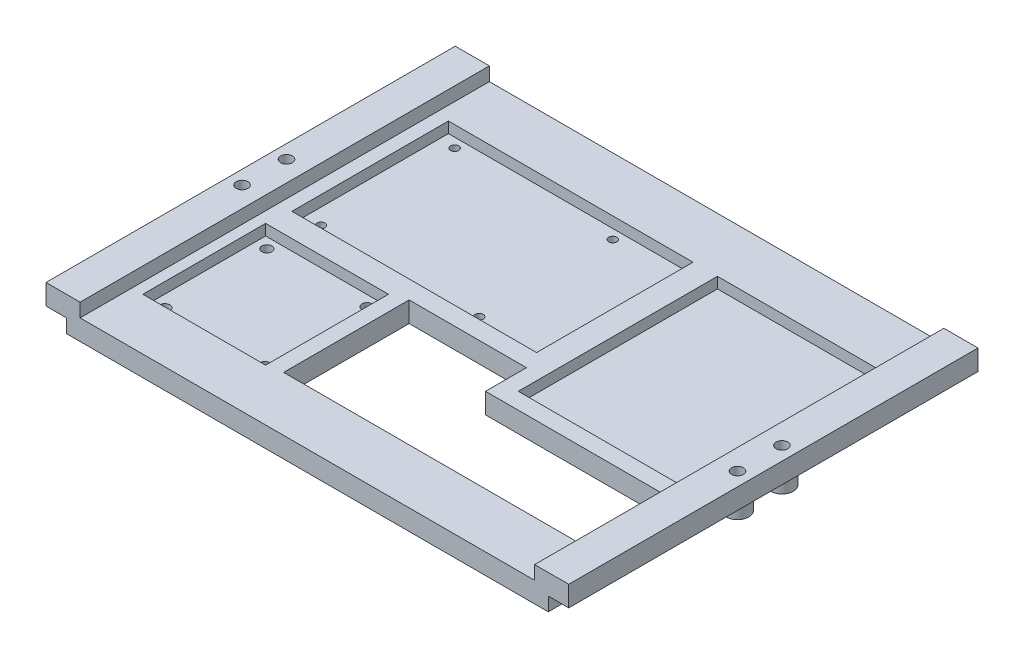
from build123d import *

# Parameters (mm, degrees)
PLATEFRAME_DEPTH          = 150
SKETCH3_R                 = 2.15
HOLESUPPORT_DEPTH         = 7.5
SKETCH4_R                 = 4.15
SKETCH4_R_2               = 2.15
CYLINDRICALSUPPORTS_DEPTH = 12.5
SKETCH5_W                 = 43
SKETCH5_H                 = 43
SKETCH5_W_2               = 89.65
SKETCH5_H_2               = 57.35
SKETCH5_W_3               = 58
SKETCH5_H_3               = 73
ITEMLAYOUT_DEPTH          = 4
HOLECUTOUT_DEPTH          = 7.5
SKETCH7_R                 = 1.5
HOLERASPBERRYPI_DEPTH     = 3.5
SKETCH8_R                 = 1.85
HOLEMOTORDRIVER_DEPTH     = 3.5
SKETCH10_W                = 45
SKETCH10_H                = 45
SKETCH10_W_2              = 43
SKETCH10_H_2              = 43
CUTMOTORDRIVER_DEPTH      = 4


with BuildPart() as part:
    # Sketch2 → PlateFrame (new body)
    with BuildSketch(Plane.XY):
        Polygon((179.1, 12.5), (191.6, 12.5), (191.6, 5), (184.1, 5), (184.1, 0), (7.5, 0), (7.5, 5), (0, 5), (0, 12.5), (12.5, 12.5), (12.5, 7.5), (179.1, 7.5), align=None)
    extrude(amount=PLATEFRAME_DEPTH)

    # Sketch3 → HoleSupport (cut)
    with BuildSketch(Plane(origin=(0, 12.5, 0), x_dir=(1, 0, 0), z_dir=(0, 1, 0))):
        with Locations((5, -66.85)):
            Circle(SKETCH3_R)
        with Locations((5, -83.15)):
            Circle(SKETCH3_R)
        with Locations((186.6, -66.85)):
            Circle(SKETCH3_R)
        with Locations((186.6, -83.15)):
            Circle(SKETCH3_R)
    extrude(amount=-HOLESUPPORT_DEPTH, mode=Mode.SUBTRACT)

    # Sketch4 → CylindricalSupports (add)
    # profile 1 of 4: a face of its own
    with BuildSketch(Plane(origin=(0, 12.5, 0), x_dir=(1, 0, 0), z_dir=(0, 1, 0))):
        with Locations((186.6, -66.85)):
            Circle(SKETCH4_R)
        with Locations((186.6, -66.85)):
            Circle(SKETCH4_R_2, mode=Mode.SUBTRACT)
    # profile 2 of 4: a face of its own
    with BuildSketch(Plane(origin=(0, 12.5, 0), x_dir=(1, 0, 0), z_dir=(0, 1, 0))):
        with Locations((186.6, -83.15)):
            Circle(SKETCH4_R)
        with Locations((186.6, -83.15)):
            Circle(SKETCH4_R_2, mode=Mode.SUBTRACT)
    # profile 3 of 4: a face of its own
    with BuildSketch(Plane(origin=(0, 12.5, 0), x_dir=(1, 0, 0), z_dir=(0, 1, 0))):
        with Locations((5, -66.85)):
            Circle(SKETCH4_R)
        with Locations((5, -66.85)):
            Circle(SKETCH4_R_2, mode=Mode.SUBTRACT)
    # profile 4 of 4: a face of its own
    with BuildSketch(Plane(origin=(0, 12.5, 0), x_dir=(1, 0, 0), z_dir=(0, 1, 0))):
        with Locations((5, -83.15)):
            Circle(SKETCH4_R)
        with Locations((5, -83.15)):
            Circle(SKETCH4_R_2, mode=Mode.SUBTRACT)
    extrude(amount=-CYLINDRICALSUPPORTS_DEPTH)

    # Sketch5 → ItemLayout (cut)
    with BuildSketch(Plane(origin=(0, 7.5, 0), x_dir=(1, 0, 0), z_dir=(0, 1, 0))):
        with Locations((39, -108.5)):
            Rectangle(SKETCH5_W, SKETCH5_H)
        with Locations((62.325, -48.675)):
            Rectangle(SKETCH5_W_2, SKETCH5_H_2)
        with Locations((145.1, -56.5)):
            Rectangle(SKETCH5_W_3, SKETCH5_H_3)
    extrude(amount=-ITEMLAYOUT_DEPTH, mode=Mode.SUBTRACT)

    # Sketch6 → HoleCutout (cut)
    with BuildSketch(Plane(origin=(0, 7.5, 0), x_dir=(1, 0, 0), z_dir=(0, 1, 0))):
        Polygon((67.1, -84), (110.1, -84), (110.1, -99), (174.1, -99), (174.1, -130), (110.1, -130), (67.1, -130), align=None)
    extrude(amount=-HOLECUTOUT_DEPTH, mode=Mode.SUBTRACT)

    # Sketch7 → HoleRaspberryPi (cut)
    with BuildSketch(Plane(origin=(0, 3.5, 0), x_dir=(1, 0, 0), z_dir=(0, 1, 0))):
        with Locations((23.26, -23.5)):
            Circle(SKETCH7_R)
        with Locations((23.26, -72.5)):
            Circle(SKETCH7_R)
        with Locations((81.26, -72.5)):
            Circle(SKETCH7_R)
        with Locations((81.26, -23.5)):
            Circle(SKETCH7_R)
    extrude(amount=-HOLERASPBERRYPI_DEPTH, mode=Mode.SUBTRACT)

    # Sketch8 → HoleMotorDriver (cut)
    with BuildSketch(Plane(origin=(0, 3.5, 0), x_dir=(1, 0, 0), z_dir=(0, 1, 0))):
        with Locations((57.56, -127.24)):
            Circle(SKETCH8_R)
        with Locations((57.56, -89.86)):
            Circle(SKETCH8_R)
        with Locations((20.81, -89.86)):
            Circle(SKETCH8_R)
        with Locations((20.81, -127.24)):
            Circle(SKETCH8_R)
    extrude(amount=-HOLEMOTORDRIVER_DEPTH, mode=Mode.SUBTRACT)

    # Sketch10 → CutMotorDriver (cut)
    with BuildSketch(Plane(origin=(0, 7.5, 0), x_dir=(1, 0, 0), z_dir=(0, 1, 0))):
        with Locations((39, -108.5)):
            Rectangle(SKETCH10_W, SKETCH10_H)
        with Locations((39, -108.5)):
            Rectangle(SKETCH10_W_2, SKETCH10_H_2, mode=Mode.SUBTRACT)
    extrude(amount=-CUTMOTORDRIVER_DEPTH, mode=Mode.SUBTRACT)


solid = part.part
